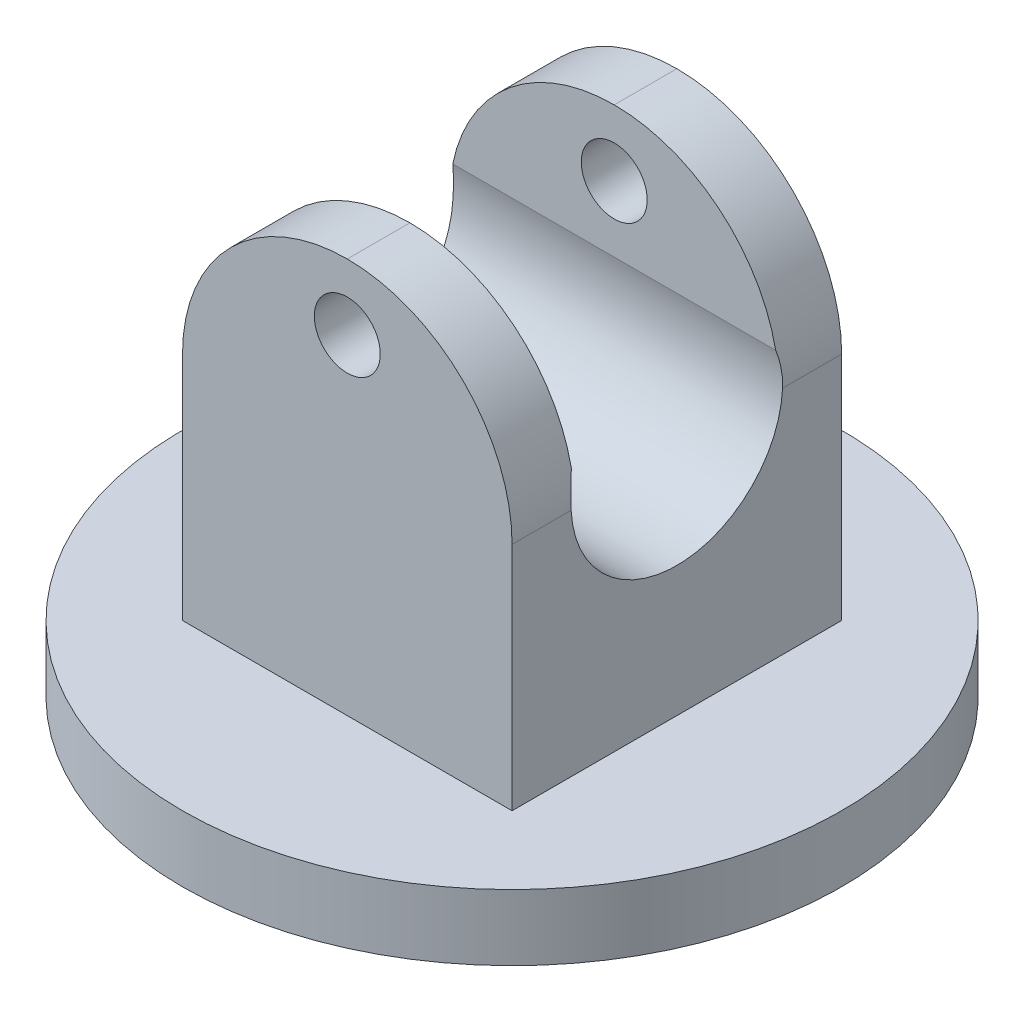
from build123d import *

# Parameters (mm, degrees)
SKETCH2_R               = 50
BOSS_EXTRUDE1_DEPTH     = 10
SKETCH3_W               = 50
SKETCH3_H               = 50
BOSS_EXTRUDE2_DEPTH     = 60
CUT_EXTRUDE1_DEPTH      = 115.127122105
CUT_EXTRUDE2_DEPTH      = 109.12145948
CUT_EXTRUDE2_DEPTH_BACK = 109.12145948
SKETCH5_R               = 5
FILLET1_R               = 25


with BuildPart() as part:
    # Sketch2 → Boss-Extrude1 (new body)
    with BuildSketch(Plane(origin=(0, 0, 0), x_dir=(1, 0, 0), z_dir=(0, 1, 0))):
        with Locations(Location((0, 0, 0), (0, 0, 270))):
            Circle(SKETCH2_R)
    extrude(amount=BOSS_EXTRUDE1_DEPTH)

    # Sketch3 → Boss-Extrude2 (add)
    with BuildSketch(Plane(origin=(0, 10, 0), x_dir=(1, 0, 0), z_dir=(0, 1, 0))):
        Rectangle(SKETCH3_W, SKETCH3_H)
    extrude(amount=BOSS_EXTRUDE2_DEPTH)

    # Sketch4 → Cut-Extrude1 (cut, through all)
    with BuildSketch(Plane(origin=(25, 0, 0), x_dir=(0, 0, -1), z_dir=(1, 0, 0))):
        with BuildLine():
            Line((-15.5, 70), (15.5, 70))
            Line((15.5, 70), (15.5, 50))
            ThreePointArc((15.5, 50), (0, 29.724643504), (-15.5, 50))
            Line((-15.5, 50), (-15.5, 70))
        make_face()
    extrude(amount=-CUT_EXTRUDE1_DEPTH, mode=Mode.SUBTRACT)

    # Sketch5 → Cut-Extrude2 (cut, two sides: drawn at the far end of the back side and taken through both)
    with BuildSketch(Plane.XY.offset(-15.5).offset(-CUT_EXTRUDE2_DEPTH_BACK)):
        with Locations((0, 60)):
            Circle(SKETCH5_R)
    extrude(amount=CUT_EXTRUDE2_DEPTH + CUT_EXTRUDE2_DEPTH_BACK, mode=Mode.SUBTRACT)

    # Fillet1
    fillet1_edges = [part.edges().sort_by_distance(p)[0] for p in [
        (25, 70, 20.25),
        (-25, 70, 20.25),
        (-25, 70, -20.25),
        (25, 70, -20.25),
    ]]
    fillet(fillet1_edges, radius=FILLET1_R - 0.0001)  # a hair under: the kernel refuses the full size


solid = part.part
